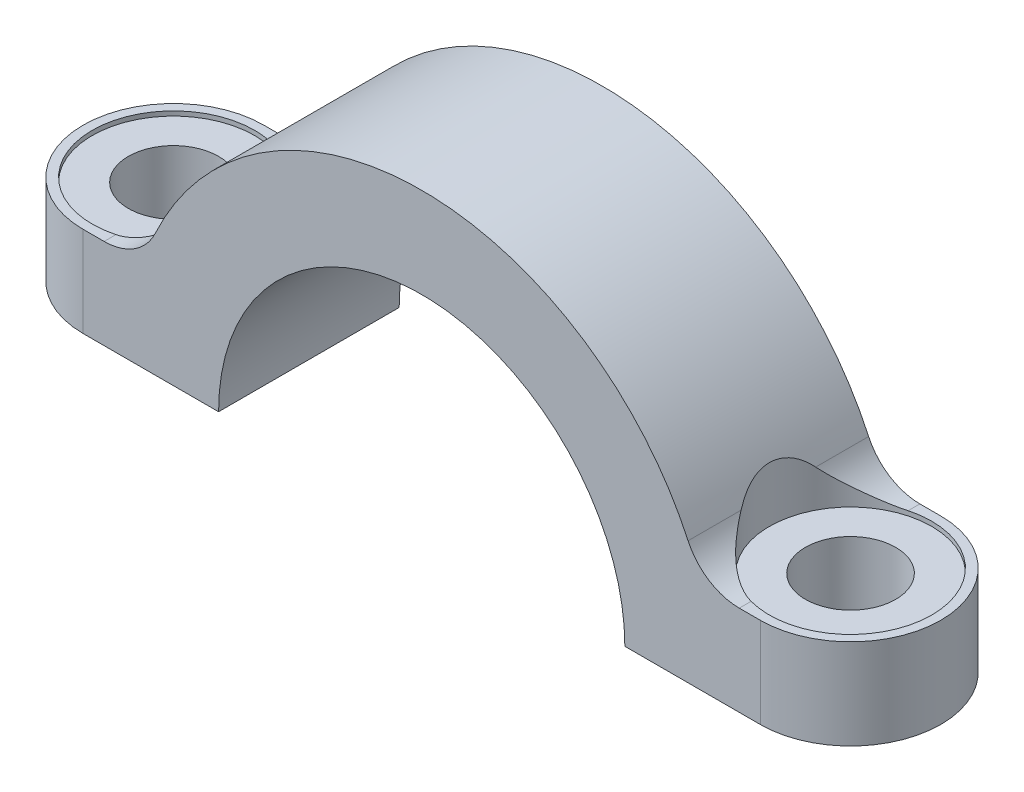
from build123d import *

# Parameters (mm, degrees)
BOSS_EXTRUDE1_DEPTH      = 8
CUT_EXTRUDE1_DEPTH       = 25.372115214
CUT_EXTRUDE1_DEPTH_BACK  = 25.372115214
SKETCH3_R                = 2
FILLET1_RADIUS           = 4
FILLET1_LENGTH           = 4
FILLET2_RADIUS           = 4
FILLET2_LENGTH           = 4
CUT_EXTRUDE2_START       = -7
CUT_EXTRUDE2_OUTLINE_R   = 3.6
CUT_EXTRUDE2_OUTLINE_R_2 = 2
CUT_EXTRUDE2_DEPTH       = 3.2


with BuildPart() as part:
    # Sketch2 → Boss-Extrude1 (new body)
    with BuildSketch(Plane.XY):
        with BuildLine():
            Line((9, 0), (19, 0))
            Line((19, 0), (19, 4))
            Line((19, 4), (14.071247279, 4))
            ThreePointArc((14.071247279, 4), (12.724207514, 4.393941152), (11.801691267, 5.451612903))
            ThreePointArc((11.801691267, 5.451612903), (0, 13), (-11.801691267, 5.451612903))
            ThreePointArc((-11.801691267, 5.451612903), (-12.724207514, 4.393941152), (-14.071247279, 4))
            Line((-14.071247279, 4), (-19, 4))
            Line((-19, 4), (-19, 0))
            Line((-19, 0), (-9, 0))
            ThreePointArc((-9, 0), (0, 9), (9, 0))
        make_face()
    extrude(amount=BOSS_EXTRUDE1_DEPTH)

    # Sketch3 → Cut-Extrude1 (cut, two sides: drawn at the far end of the back side and taken through both)
    with BuildSketch(Plane.XZ.offset(-CUT_EXTRUDE1_DEPTH_BACK)):
        with Locations(Location((15, 4, 0), (0, 0, 242.330131357))):
            Circle(SKETCH3_R)
        with Locations(Location((-15, 4, 0), (0, 0, 297.669868622))):
            Circle(SKETCH3_R)
    extrude(amount=CUT_EXTRUDE1_DEPTH + CUT_EXTRUDE1_DEPTH_BACK, mode=Mode.SUBTRACT)

    # Fillet1: full round fillet: the end face becomes a half cylinder, R = half its width
    fillet1_face = Plane((-19, 2, 4), x_dir=(0, 1, 0), z_dir=(-1, 0, 0))  # on the end face: x along it, z out of the body
    fillet1_slab = fillet1_face.offset(-FILLET1_RADIUS / 2) * Box(FILLET1_LENGTH, 2 * FILLET1_RADIUS, FILLET1_RADIUS, mode=Mode.PRIVATE)  # the body's end, R deep
    fillet1_round = Plane((-15, 2, 4), x_dir=(-1, 0, 0), z_dir=(0, 1, 0)) * Cylinder(FILLET1_RADIUS, FILLET1_LENGTH, mode=Mode.PRIVATE)  # its axis R under the face
    add(fillet1_slab - fillet1_round, mode=Mode.SUBTRACT)

    # Fillet2: full round fillet: the end face becomes a half cylinder, R = half its width
    fillet2_face = Plane((19, 2, 4), x_dir=(0, 1, 0), z_dir=(1, 0, 0))  # on the end face: x along it, z out of the body
    fillet2_slab = fillet2_face.offset(-FILLET2_RADIUS / 2) * Box(FILLET2_LENGTH, 2 * FILLET2_RADIUS, FILLET2_RADIUS, mode=Mode.PRIVATE)  # the body's end, R deep
    fillet2_round = Plane((15, 2, 4), x_dir=(1, 0, 0), z_dir=(0, 1, 0)) * Cylinder(FILLET2_RADIUS, FILLET2_LENGTH, mode=Mode.PRIVATE)  # its axis R under the face
    add(fillet2_slab - fillet2_round, mode=Mode.SUBTRACT)

    # Cut-Extrude2: read off the stored shape, not the designer's step
    # Cut-Extrude2 outline → Cut-Extrude2 (cut)
    # profile 1 of 2: a face of its own
    with BuildSketch(Plane.XZ.offset(CUT_EXTRUDE2_START)):
        with Locations((-15, 4)):
            Circle(CUT_EXTRUDE2_OUTLINE_R)
        with Locations((-15, 4)):
            Circle(CUT_EXTRUDE2_OUTLINE_R_2, mode=Mode.SUBTRACT)
    # profile 2 of 2: a face of its own
    with BuildSketch(Plane.XZ.offset(CUT_EXTRUDE2_START)):
        with Locations((15, 4)):
            Circle(CUT_EXTRUDE2_OUTLINE_R)
        with Locations((15, 4)):
            Circle(CUT_EXTRUDE2_OUTLINE_R_2, mode=Mode.SUBTRACT)
    extrude(amount=CUT_EXTRUDE2_DEPTH, mode=Mode.SUBTRACT)


solid = part.part
